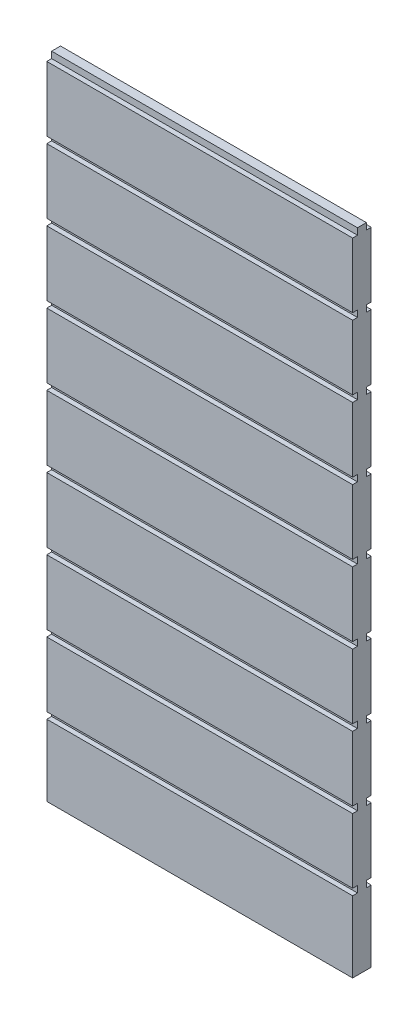
from build123d import *

# Parameters (mm, degrees)
PARTSCAB_REFERENCE_START = -1615.650675561
PARTSCAB_REFERENCE_DEPTH = 1475.316666667
SKETCH1_OUTSIDE_W        = 1806.569
SKETCH1_OUTSIDE_H        = 1061.502
SKETCH1_OUTSIDE_W_2      = 300.0375
SKETCH1_OUTSIDE_H_2      = 730.25
CUT_EXTRUDE1_DEPTH       = 1820.964329577
SKETCH2_W                = 300.0375
SKETCH2_H                = 95.25
CUT_EXTRUDE2_DEPTH       = 947.50415812


# Read off the part's stored shape, not the designer's step: PartsCab_Reference
with BuildPart() as part:
    # PartsCab_Reference outline → PartsCab_Reference (new body)
    with BuildSketch(Plane.YZ.offset(PARTSCAB_REFERENCE_START)):
        Polygon((107.371492578, 9.178125), (107.371492578, -9.078125), (177.221492578, -9.078125), (177.221492578, -4.315625), (183.571492578, -4.315625), (183.571492578, -9.078125), (247.071492578, -9.078125), (247.071492578, -4.315625), (253.421492578, -4.315625), (253.421492578, -9.078125), (316.921492578, -9.078125), (316.921492578, -4.315625), (323.271492578, -4.315625), (323.271492578, -9.078125), (386.771492578, -9.078125), (386.771492578, -4.315625), (393.121492578, -4.315625), (393.121492578, -9.078125), (456.621492578, -9.078125), (456.621492578, -4.315625), (462.971492578, -4.315625), (462.971492578, -9.078125), (526.471492578, -9.078125), (526.471492578, -4.315625), (532.821492578, -4.315625), (532.821492578, -9.078125), (596.321492578, -9.078125), (596.321492578, -4.315625), (602.671492578, -4.315625), (602.671492578, -9.078125), (666.171492578, -9.078125), (666.171492578, -4.315625), (672.521492578, -4.315625), (672.521492578, -9.078125), (736.021492578, -9.078125), (736.021492578, -4.315625), (742.371492578, -4.315625), (742.371492578, -9.078125), (837.621492578, -9.078125), (837.621492578, 9.178125), (742.371492578, 9.178125), (742.371492578, 4.415625), (736.021492578, 4.415625), (736.021492578, 9.178125), (672.521492578, 9.178125), (672.521492578, 4.415625), (666.171492578, 4.415625), (666.171492578, 9.178125), (602.671492578, 9.178125), (602.671492578, 4.415625), (596.321492578, 4.415625), (596.321492578, 9.178125), (532.821492578, 9.178125), (532.821492578, 4.415625), (526.471492578, 4.415625), (526.471492578, 9.178125), (462.971492578, 9.178125), (462.971492578, 4.415625), (456.621492578, 4.415625), (456.621492578, 9.178125), (393.121492578, 9.178125), (393.121492578, 4.415625), (386.771492578, 4.415625), (386.771492578, 9.178125), (323.271492578, 9.178125), (323.271492578, 4.415625), (316.921492578, 4.415625), (316.921492578, 9.178125), (253.421492578, 9.178125), (253.421492578, 4.415625), (247.071492578, 4.415625), (247.071492578, 9.178125), (183.571492578, 9.178125), (183.571492578, 4.415625), (177.221492578, 4.415625), (177.221492578, 9.178125), align=None)
    extrude(amount=PARTSCAB_REFERENCE_DEPTH)

    # Sketch1 outside → Cut-Extrude1 (cut, through all)
    with BuildSketch(Plane.XY.offset(9.178125)):
        with Locations((-877.9925, 472.496)):
            Rectangle(SKETCH1_OUTSIDE_W, SKETCH1_OUTSIDE_H)
        with Locations((-290.352758894, 472.496492578)):
            Rectangle(SKETCH1_OUTSIDE_W_2, SKETCH1_OUTSIDE_H_2, mode=Mode.SUBTRACT)
    extrude(amount=-CUT_EXTRUDE1_DEPTH, mode=Mode.SUBTRACT)

    # Sketch2 → Cut-Extrude2 (cut, through all)
    with BuildSketch(Plane.XY.offset(9.178125)):
        with Locations((-290.352758894, 789.996492578)):
            Rectangle(SKETCH2_W, SKETCH2_H)
    extrude(amount=-CUT_EXTRUDE2_DEPTH, mode=Mode.SUBTRACT)


solid = part.part
